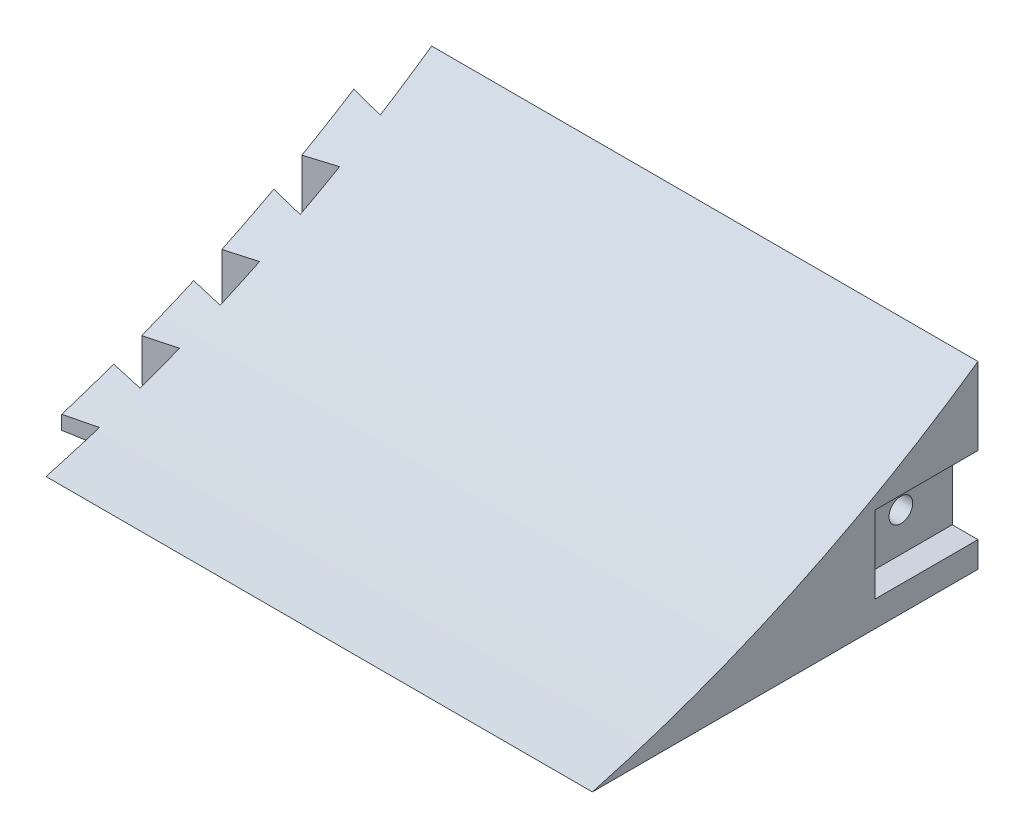
from build123d import *

# Parameters (mm, degrees)
BOSS_EXTRUDE1_DEPTH = 134.9375
SKETCH4_W           = 25.4
SKETCH4_H           = 19.05
CUT_EXTRUDE1_DEPTH  = 6.35
SKETCH6_R           = 2.921
CUT_EXTRUDE3_DEPTH  = 25.4
BOSS_EXTRUDE2_DEPTH = 38.1
CUT_EXTRUDE4_DEPTH  = 178.362410906


with BuildPart() as part:
    # Sketch3 → Boss-Extrude1 (new body)
    with BuildSketch(Plane(origin=(0, 0, 0), x_dir=(0, 0, -1), z_dir=(1, 0, 0))):
        with BuildLine():
            Line((0, 0), (95.25, 0))
            Line((95.25, 0), (95.25, 44.45))
            ThreePointArc((95.25, 44.45), (49.555547135, 18.088113282), (0, 0))
        make_face()
    extrude(amount=BOSS_EXTRUDE1_DEPTH)

    # Sketch4 → Cut-Extrude1 (cut)
    with BuildSketch(Plane(origin=(134.9375, 0, 0), x_dir=(0, 0, -1), z_dir=(1, 0, 0))):
        with Locations((82.55, 15.875)):
            Rectangle(SKETCH4_W, SKETCH4_H)
    extrude(amount=-CUT_EXTRUDE1_DEPTH, mode=Mode.SUBTRACT)

    # Sketch6 → Cut-Extrude3 (cut)
    with BuildSketch(Plane(origin=(128.5875, 0, 0), x_dir=(0, 0, -1), z_dir=(1, 0, 0))):
        with Locations((82.55, 15.875)):
            Circle(SKETCH6_R)
    extrude(amount=-CUT_EXTRUDE3_DEPTH, mode=Mode.SUBTRACT)

    # Sketch7 → Boss-Extrude2 (add)
    with BuildSketch(Plane.XZ):
        Polygon((0, -82.55), (-7.922780702, -83.947), (-7.922780702, -71.12), (0, -72.517), align=None)
        Polygon((0, -62.780333333), (-7.922780702, -64.177333333), (-7.922780702, -51.350333333), (0, -52.747333333), align=None)
        Polygon((0, -43.010666667), (-7.922780702, -44.407666667), (-7.922780702, -31.580666667), (0, -32.977666667), align=None)
        Polygon((0, -23.241), (-7.922780702, -24.638), (-7.922780702, -11.811), (0, -13.208), align=None)
    extrude(amount=-BOSS_EXTRUDE2_DEPTH)

    # Sketch8 → Cut-Extrude4 (cut, through all)
    with BuildSketch(Plane(origin=(134.9375, 0, 0), x_dir=(0, 0, -1), z_dir=(1, 0, 0))):
        with BuildLine():
            Line((95.25, 44.45), (0, 44.45))
            Line((0, 44.45), (0, 0))
            ThreePointArc((0, 0), (49.555547135, 18.088113282), (95.25, 44.45))
        make_face()
    extrude(amount=-CUT_EXTRUDE4_DEPTH, mode=Mode.SUBTRACT)


solid = part.part
